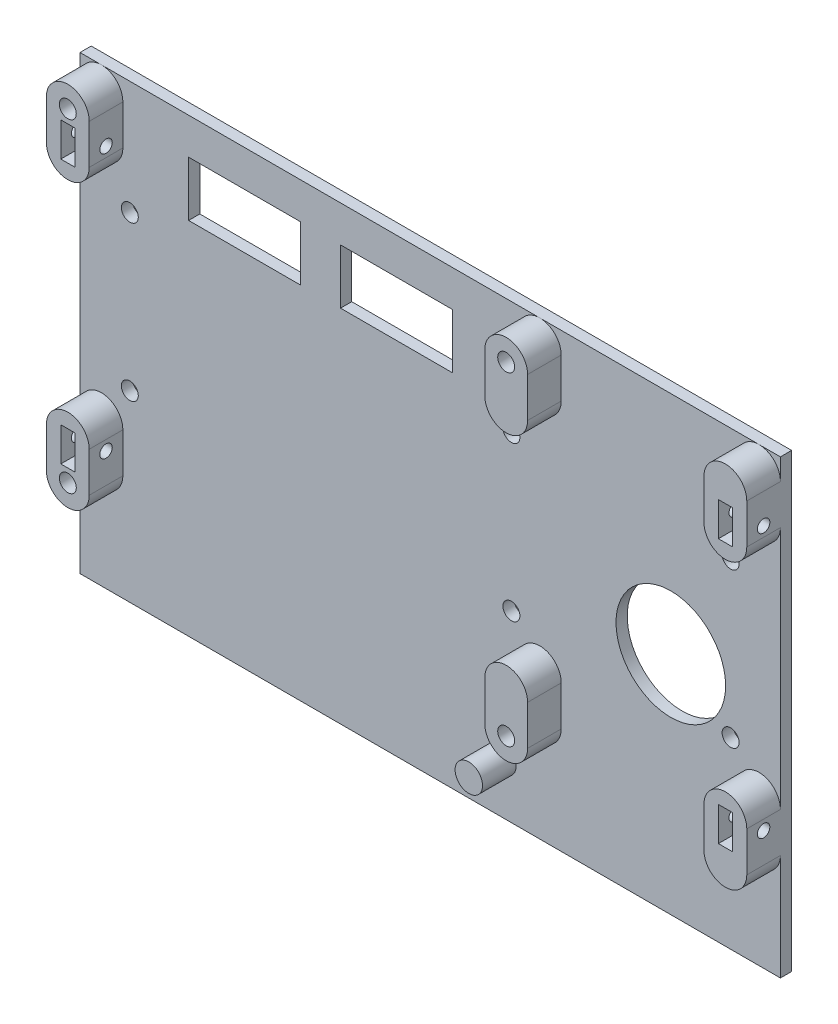
from build123d import *

# Parameters (mm, degrees)
BACK_START                               = -2.5
BACK_PLATE_BODY_OUTLINE_W                = 140.7
BACK_PLATE_BODY_OUTLINE_H                = 90.7
BACK_PLATE_BODY_OUTLINE_R                = 3.175426481
BACK_PLATE_BODY_OUTLINE_R_2              = 1.7
BACK_PLATE_BODY_OUTLINE_W_2              = 22.5
BACK_PLATE_BODY_OUTLINE_H_2              = 11
BACK_PLATE_BODY_DEPTH                    = 2.5
BACK_START_2                             = 1.4999999
BACK_PLATE_BODY_2_OUTLINE_R              = 3.175426481
BACK_PLATE_BODY_2_OUTLINE_R_2            = 1.7
BACK_PLATE_BODY_2_OUTLINE_R_3            = 2.75
BACK_PLATE_BODY_2_DEPTH                  = 5.0000001
BACK_PLATE_BODY_3_OUTLINE_R              = 2.75
BACK_PLATE_BODY_3_DEPTH                  = 1.9999999
BACK_START_3                             = 6.425426481
BACK_PLATE_BODY_4_OUTLINE_R              = 3.175426481
BACK_PLATE_BODY_4_DEPTH                  = 0.074573519
BACK_PLATE_BODY_5_OUTLINE_R              = 3.175426481
BACK_PLATE_BODY_5_DEPTH                  = 0.074573419
BACK_START_4                             = 0.074573419
BACK_PLATE_BODY_6_OUTLINE_R              = 3.175426481
BACK_PLATE_BODY_6_DEPTH                  = 6.350853062
BACK_PLATE_BODY_7_OUTLINE_R              = 3.175426481
BACK_PLATE_BODY_7_DEPTH                  = 1.425426481
BACK_START_5                             = -42.05
BACK_PLATE_BODY_12_OUTLINE_R             = 3.175426481
BACK_PLATE_BODY_12_DEPTH                 = 84.1
BACK_START_6                             = -48.35
BACK_PLATE_BODY_13_OUTLINE_R             = 1.25
BACK_PLATE_BODY_13_DEPTH                 = 96.7
BACK_PLATE_OUTLINE_W                     = 140.7
BACK_PLATE_OUTLINE_H                     = 90.7
BACK_PLATE_OUTLINE_W_2                   = 96.6
BACK_PLATE_OUTLINE_H_2                   = 90.6
BACK_PLATE_OUTLINE_R                     = 1.7
BACK_PLATE_OUTLINE_R_2                   = 3.175426481
BACK_PLATE_DEPTH                         = 9
BACK_PLATE_2_OUTLINE_R                   = 3.175426481
BACK_PLATE_2_OUTLINE_R_2                 = 2.75
BACK_PLATE_2_DEPTH                       = 6.5
BACK_PLATE_3_OUTLINE_W                   = 96.6
BACK_PLATE_3_OUTLINE_H                   = 90.6
BACK_PLATE_3_OUTLINE_R                   = 3.175426481
BACK_PLATE_3_DEPTH                       = 0.25
BACK_START_7                             = -2.25
BACK_PLATE_4_DEPTH                       = 2.25
STOP_BUTTON_EXTENSION_SKETCH_W           = 44
STOP_BUTTON_EXTENSION_SKETCH_H           = 90.6
STOP_BUTTON_EXTENSION_SKETCH_R           = 1.7
STOP_BUTTON_EXTENSION_SKETCH_R_2         = 11
STOP_BUTTON_EXTENSION_DEPTH              = 2.25
STAND_OFFS_SKETCH_R                      = 2.75
STAND_OFFS_SKETCH_R_2                    = 1.7
STAND_OFFS_DEPTH                         = 6.75
STOP_BUTTON_STAND_OFFS_EXTRUDE_DEPTH     = 6.75
PCB_NUT_NO_SUPPORT_CHAMFER_SIZE          = 1.5
TOP_CONNECTORS_SKETCH_R                  = 1.25
TOP_CONNECTORS_LEFT_CUT_DEPTH            = 104.038548612
TOP_START                                = 83.7
TOP_CONNECTORS_SKETCH_3_R                = 1.25
TOP_CONNECTORS_STOP_BUTTON_CUT_DEPTH     = 8.6
TOP_START_2                              = -44
TOP_CONNECTORS_LEFT_NUT_CUT_DEPTH        = 1.4
TOP_START_3                              = 88
TOP_CONNECTORS_STOP_BUTTON_NUT_CUT_DEPTH = 1.4


with BuildPart() as part:
    # Back Plate Body: read off the stored shape, not the designer's step
    # Back Plate Body outline → Back Plate Body (new body)
    with BuildSketch(Plane.XY.offset(BACK_START)):
        with Locations((22, 0)):
            Rectangle(BACK_PLATE_BODY_OUTLINE_W, BACK_PLATE_BODY_OUTLINE_H)
        with Locations((44, -24)):
            Circle(BACK_PLATE_BODY_OUTLINE_R, mode=Mode.SUBTRACT)
        with Locations((-38.35, -7.5)):
            Circle(BACK_PLATE_BODY_OUTLINE_R_2, mode=Mode.SUBTRACT)
        with Locations((38.35, -7.5)):
            Circle(BACK_PLATE_BODY_OUTLINE_R_2, mode=Mode.SUBTRACT)
        with Locations((82.35, -7.5)):
            Circle(BACK_PLATE_BODY_OUTLINE_R_2, mode=Mode.SUBTRACT)
        with Locations((-38.35, 22.5)):
            Circle(BACK_PLATE_BODY_OUTLINE_R_2, mode=Mode.SUBTRACT)
        with Locations((-15.25, 32.5)):
            Rectangle(BACK_PLATE_BODY_OUTLINE_W_2, BACK_PLATE_BODY_OUTLINE_H_2, mode=Mode.SUBTRACT)
        with Locations((15.25, 32.5)):
            Rectangle(BACK_PLATE_BODY_OUTLINE_W_2, BACK_PLATE_BODY_OUTLINE_H_2, mode=Mode.SUBTRACT)
        with Locations((38.35, 22.5)):
            Circle(BACK_PLATE_BODY_OUTLINE_R_2, mode=Mode.SUBTRACT)
        with Locations((82.35, 22.5)):
            Circle(BACK_PLATE_BODY_OUTLINE_R_2, mode=Mode.SUBTRACT)
        with Locations((-44, -24)):
            Circle(BACK_PLATE_BODY_OUTLINE_R, mode=Mode.SUBTRACT)
        with Locations((-44, 41)):
            Circle(BACK_PLATE_BODY_OUTLINE_R, mode=Mode.SUBTRACT)
        with Locations((44, 41)):
            Circle(BACK_PLATE_BODY_OUTLINE_R, mode=Mode.SUBTRACT)
    extrude(amount=BACK_PLATE_BODY_DEPTH)



with BuildPart() as body_2:
    # Back Plate Body 2 outline → Back Plate Body 2 (new body)
    # profile 1 of 5: a face of its own
    with BuildSketch(Plane.XY.offset(BACK_START_2)):
        with Locations((-44, 41)):
            Circle(BACK_PLATE_BODY_2_OUTLINE_R)
        with Locations((-44, 41)):
            Circle(BACK_PLATE_BODY_2_OUTLINE_R_2, mode=Mode.SUBTRACT)
    # profile 2 of 5: a face of its own
    with BuildSketch(Plane.XY.offset(BACK_START_2)):
        with Locations((44, 41)):
            Circle(BACK_PLATE_BODY_2_OUTLINE_R)
        with Locations((44, 41)):
            Circle(BACK_PLATE_BODY_2_OUTLINE_R_2, mode=Mode.SUBTRACT)
    # profile 3 of 5: a face of its own
    with BuildSketch(Plane.XY.offset(BACK_START_2)):
        with Locations((-44, -24)):
            Circle(BACK_PLATE_BODY_2_OUTLINE_R)
        with Locations((-44, -24)):
            Circle(BACK_PLATE_BODY_2_OUTLINE_R_2, mode=Mode.SUBTRACT)
    # profile 4 of 5: a face of its own
    with BuildSketch(Plane.XY.offset(BACK_START_2)):
        with Locations((44, -24)):
            Circle(BACK_PLATE_BODY_2_OUTLINE_R)
        with Locations((44, -24)):
            Circle(BACK_PLATE_BODY_2_OUTLINE_R_2, mode=Mode.SUBTRACT)
    # profile 5 of 5: a face of its own
    with BuildSketch(Plane.XY.offset(BACK_START_2)):
        with Locations((36.5, -35)):
            Circle(BACK_PLATE_BODY_2_OUTLINE_R_3)
    extrude(amount=BACK_PLATE_BODY_2_DEPTH)


with BuildPart() as part_1:
    add(part.part)

    add(body_2.part)  # Back Plate Body 3 merges body 2
    # Back Plate Body 3 outline → Back Plate Body 3 (add)
    with BuildSketch(Plane.XY):
        with Locations((36.5, -35)):
            Circle(BACK_PLATE_BODY_3_OUTLINE_R)
    extrude(amount=BACK_PLATE_BODY_3_DEPTH)

    # Back Plate Body 4 outline → Back Plate Body 4 (add)
    # profile 1 of 4: a face of its own
    with BuildSketch(Plane.XY.offset(BACK_START_3)):
        with BuildLine():
            ThreePointArc((48.35, -16), (44, -11.65), (39.65, -16))
            Line((39.65, -16), (39.65, -24))
            ThreePointArc((39.65, -24), (44, -28.35), (48.35, -24))
            Line((48.35, -24), (48.35, -16))
        make_face()
        with Locations((44, -24)):
            Circle(BACK_PLATE_BODY_4_OUTLINE_R, mode=Mode.SUBTRACT)
    # profile 2 of 4: a face of its own
    with BuildSketch(Plane.XY.offset(BACK_START_3)):
        with BuildLine():
            ThreePointArc((39.65, 33), (44, 28.65), (48.35, 33))
            Line((48.35, 33), (48.35, 41))
            ThreePointArc((48.35, 41), (44, 45.35), (39.65, 41))
            Line((39.65, 41), (39.65, 33))
        make_face()
        with Locations((44, 41)):
            Circle(BACK_PLATE_BODY_4_OUTLINE_R, mode=Mode.SUBTRACT)
    # profile 3 of 4: a face of its own
    with BuildSketch(Plane.XY.offset(BACK_START_3)):
        with BuildLine():
            ThreePointArc((-39.65, 41), (-44, 45.35), (-48.35, 41))
            Line((-48.35, 41), (-48.35, 33))
            ThreePointArc((-48.35, 33), (-44, 28.65), (-39.65, 33))
            Line((-39.65, 33), (-39.65, 41))
        make_face()
        with Locations((-44, 41)):
            Circle(BACK_PLATE_BODY_4_OUTLINE_R, mode=Mode.SUBTRACT)
    # profile 4 of 4: a face of its own
    with BuildSketch(Plane.XY.offset(BACK_START_3)):
        with BuildLine():
            Line((-48.35, -16), (-48.35, -24))
            ThreePointArc((-48.35, -24), (-44, -28.35), (-39.65, -24))
            Line((-39.65, -24), (-39.65, -16))
            ThreePointArc((-39.65, -16), (-44, -11.65), (-48.35, -16))
        make_face()
        with Locations((-44, -24)):
            Circle(BACK_PLATE_BODY_4_OUTLINE_R, mode=Mode.SUBTRACT)
    extrude(amount=BACK_PLATE_BODY_4_DEPTH)

    # Back Plate Body 5 outline → Back Plate Body 5 (add)
    # profile 1 of 4: a face of its own
    with BuildSketch(Plane.XY):
        with BuildLine():
            ThreePointArc((48.35, -16), (44, -11.65), (39.65, -16))
            Line((39.65, -16), (39.65, -24))
            ThreePointArc((39.65, -24), (44, -28.35), (48.35, -24))
            Line((48.35, -24), (48.35, -16))
        make_face()
        with Locations((44, -24)):
            Circle(BACK_PLATE_BODY_5_OUTLINE_R, mode=Mode.SUBTRACT)
    # profile 2 of 4: a face of its own
    with BuildSketch(Plane.XY):
        with BuildLine():
            ThreePointArc((39.65, 33), (44, 28.65), (48.35, 33))
            Line((48.35, 33), (48.35, 41))
            ThreePointArc((48.35, 41), (44, 45.35), (39.65, 41))
            Line((39.65, 41), (39.65, 33))
        make_face()
        with Locations((44, 41)):
            Circle(BACK_PLATE_BODY_5_OUTLINE_R, mode=Mode.SUBTRACT)
    # profile 3 of 4: a face of its own
    with BuildSketch(Plane.XY):
        with BuildLine():
            ThreePointArc((-39.65, 41), (-44, 45.35), (-48.35, 41))
            Line((-48.35, 41), (-48.35, 33))
            ThreePointArc((-48.35, 33), (-44, 28.65), (-39.65, 33))
            Line((-39.65, 33), (-39.65, 41))
        make_face()
        with Locations((-44, 41)):
            Circle(BACK_PLATE_BODY_5_OUTLINE_R, mode=Mode.SUBTRACT)
    # profile 4 of 4: a face of its own
    with BuildSketch(Plane.XY):
        with BuildLine():
            Line((-48.35, -16), (-48.35, -24))
            ThreePointArc((-48.35, -24), (-44, -28.35), (-39.65, -24))
            Line((-39.65, -24), (-39.65, -16))
            ThreePointArc((-39.65, -16), (-44, -11.65), (-48.35, -16))
        make_face()
        with Locations((-44, -24)):
            Circle(BACK_PLATE_BODY_5_OUTLINE_R, mode=Mode.SUBTRACT)
    extrude(amount=BACK_PLATE_BODY_5_DEPTH)

    # Back Plate Body 6 outline → Back Plate Body 6 (add)
    # profile 1 of 4: a face of its own
    with BuildSketch(Plane.XY.offset(BACK_START_4)):
        with BuildLine():
            ThreePointArc((48.35, -16), (44, -11.65), (39.65, -16))
            Line((39.65, -16), (39.65, -24))
            ThreePointArc((39.65, -24), (44, -28.35), (48.35, -24))
            Line((48.35, -24), (48.35, -16))
        make_face()
        with Locations((44, -24)):
            Circle(BACK_PLATE_BODY_6_OUTLINE_R, mode=Mode.SUBTRACT)
    # profile 2 of 4: a face of its own
    with BuildSketch(Plane.XY.offset(BACK_START_4)):
        with BuildLine():
            ThreePointArc((39.65, 33), (44, 28.65), (48.35, 33))
            Line((48.35, 33), (48.35, 41))
            ThreePointArc((48.35, 41), (44, 45.35), (39.65, 41))
            Line((39.65, 41), (39.65, 33))
        make_face()
        with Locations((44, 41)):
            Circle(BACK_PLATE_BODY_6_OUTLINE_R, mode=Mode.SUBTRACT)
    # profile 3 of 4: a face of its own
    with BuildSketch(Plane.XY.offset(BACK_START_4)):
        with BuildLine():
            ThreePointArc((-39.65, -16), (-44, -11.65), (-48.35, -16))
            Line((-48.35, -16), (-48.35, -24))
            ThreePointArc((-48.35, -24), (-44, -28.35), (-39.65, -24))
            Line((-39.65, -24), (-39.65, -16))
        make_face()
        with Locations((-44, -24)):
            Circle(BACK_PLATE_BODY_6_OUTLINE_R, mode=Mode.SUBTRACT)
    # profile 4 of 4: a face of its own
    with BuildSketch(Plane.XY.offset(BACK_START_4)):
        with BuildLine():
            ThreePointArc((-48.35, 33), (-44, 28.65), (-39.65, 33))
            Line((-39.65, 33), (-39.65, 41))
            ThreePointArc((-39.65, 41), (-44, 45.35), (-48.35, 41))
            Line((-48.35, 41), (-48.35, 33))
        make_face()
        with Locations((-44, 41)):
            Circle(BACK_PLATE_BODY_6_OUTLINE_R, mode=Mode.SUBTRACT)
    extrude(amount=BACK_PLATE_BODY_6_DEPTH)

    # Back Plate Body 7 outline → Back Plate Body 7 (add)
    with BuildSketch(Plane.XY.offset(BACK_START_4)):
        with Locations((-44, 41)):
            Circle(BACK_PLATE_BODY_7_OUTLINE_R)
        with Locations((44, 41)):
            Circle(BACK_PLATE_BODY_7_OUTLINE_R)
        with Locations((-44, -24)):
            Circle(BACK_PLATE_BODY_7_OUTLINE_R)
        with Locations((44, -24)):
            Circle(BACK_PLATE_BODY_7_OUTLINE_R)
    extrude(amount=BACK_PLATE_BODY_7_DEPTH)

    # Back Plate Body 8 outline → Back Plate Body 8 (revolve)
    with BuildSketch(Plane(origin=(-44, 41, 0), x_dir=(1, 0, 0), z_dir=(0, -1, 0))):
        Polygon((3.175426481, 0.074573419), (3.125426581, 0.074573419), (3.175426481, 0.024573519), align=None)
    revolve(axis=Axis((-44, 41, 0), (0, 0, 1)))

    # Back Plate Body 9 outline → Back Plate Body 9 (revolve)
    with BuildSketch(Plane(origin=(-44, -24, 0), x_dir=(1, 0, 0), z_dir=(0, -1, 0))):
        Polygon((3.175426481, 0.074573419), (3.125426581, 0.074573419), (3.175426481, 0.024573519), align=None)
    revolve(axis=Axis((-44, -24, 0), (0, 0, 1)))

    # Back Plate Body 10 outline → Back Plate Body 10 (revolve)
    with BuildSketch(Plane(origin=(44, -24, 0), x_dir=(1, 0, 0), z_dir=(0, -1, 0))):
        Polygon((3.175426481, 0.074573419), (3.125426581, 0.074573419), (3.175426481, 0.024573519), align=None)
    revolve(axis=Axis((44, -24, 0), (0, 0, 1)))

    # Back Plate Body 11 outline → Back Plate Body 11 (revolve)
    with BuildSketch(Plane(origin=(44, 41, 0), x_dir=(1, 0, 0), z_dir=(0, -1, 0))):
        Polygon((3.175426481, 0.074573419), (3.125426581, 0.074573419), (3.175426481, 0.024573519), align=None)
    revolve(axis=Axis((44, 41, 0), (0, 0, 1)))

    # Back Plate Body 12 outline → Back Plate Body 12 (cut)
    with BuildSketch(Plane.YZ.offset(BACK_START_5)):
        with Locations((35, 3.25)):
            Circle(BACK_PLATE_BODY_12_OUTLINE_R)
        with Locations((-18, 3.25)):
            Circle(BACK_PLATE_BODY_12_OUTLINE_R)
    extrude(amount=BACK_PLATE_BODY_12_DEPTH, mode=Mode.SUBTRACT)

    # Back Plate Body 13 outline → Back Plate Body 13 (cut)
    with BuildSketch(Plane.YZ.offset(BACK_START_6)):
        with Locations((35, 3.25)):
            Circle(BACK_PLATE_BODY_13_OUTLINE_R)
        with Locations((-18, 3.25)):
            Circle(BACK_PLATE_BODY_13_OUTLINE_R)
    extrude(amount=BACK_PLATE_BODY_13_DEPTH, mode=Mode.SUBTRACT)

    # Back Plate Body 14 outline → Back Plate Body 14 (revolve, cut)
    with BuildSketch(Plane(origin=(-44, 41, 0), x_dir=(1, 0, 0), z_dir=(0, -1, 0))):
        Polygon((3.125426581, 0.074573419), (1.7, 1.5), (0, 1.4999999), (0, 0.074573419), align=None)
    revolve(axis=Axis((-44, 41, 0), (0, 0, 1)), mode=Mode.SUBTRACT)

    # Back Plate Body 15 outline → Back Plate Body 15 (revolve, cut)
    with BuildSketch(Plane(origin=(-44, -24, 0), x_dir=(1, 0, 0), z_dir=(0, -1, 0))):
        Polygon((3.125426581, 0.074573419), (1.7, 1.5), (0, 1.4999999), (0, 0.074573419), align=None)
    revolve(axis=Axis((-44, -24, 0), (0, 0, 1)), mode=Mode.SUBTRACT)

    # Back Plate Body 16 outline → Back Plate Body 16 (revolve, cut)
    with BuildSketch(Plane(origin=(44, -24, 0), x_dir=(1, 0, 0), z_dir=(0, -1, 0))):
        Polygon((3.125426581, 0.074573419), (1.7, 1.5), (0, 1.4999999), (0, 0.074573419), align=None)
    revolve(axis=Axis((44, -24, 0), (0, 0, 1)), mode=Mode.SUBTRACT)

    # Back Plate Body 17 outline → Back Plate Body 17 (revolve, cut)
    with BuildSketch(Plane(origin=(44, 41, 0), x_dir=(1, 0, 0), z_dir=(0, -1, 0))):
        Polygon((3.125426581, 0.074573419), (1.7, 1.5), (0, 1.4999999), (0, 0.074573419), align=None)
    revolve(axis=Axis((44, 41, 0), (0, 0, 1)), mode=Mode.SUBTRACT)

    # Back Plate: read off the stored shape, not the designer's step
    # Back Plate outline → Back Plate (cut)
    # profile 1 of 9: a face of its own
    with BuildSketch(Plane.XY.offset(BACK_START)):
        with Locations((22, 0)):
            Rectangle(BACK_PLATE_OUTLINE_W, BACK_PLATE_OUTLINE_H)
        Rectangle(BACK_PLATE_OUTLINE_W_2, BACK_PLATE_OUTLINE_H_2, mode=Mode.SUBTRACT)
        with Locations((82.35, -7.5)):
            Circle(BACK_PLATE_OUTLINE_R, mode=Mode.SUBTRACT)
        with Locations((82.35, 22.5)):
            Circle(BACK_PLATE_OUTLINE_R, mode=Mode.SUBTRACT)
    # profile 2 of 9: a face of its own
    with BuildSketch(Plane.XY.offset(BACK_START)):
        with BuildLine():
            ThreePointArc((-39.94758837, -8.081129418), (-38.215106051, -10.197878976), (-36.70241163, -7.918870582))
            ThreePointArc((-36.70241163, -7.918870582), (-38.265106051, -9.197878976), (-39.94758837, -8.081129418))
        make_face()
    # profile 3 of 9: a face of its own
    with BuildSketch(Plane.XY.offset(BACK_START)):
        with BuildLine():
            ThreePointArc((-38.325, 20.800183833), (-36.6, 22.5), (-38.325, 24.199816167))
            ThreePointArc((-38.325, 24.199816167), (-36.65, 22.5), (-38.325, 20.800183833))
        make_face()
    # profile 4 of 9: a face of its own
    with BuildSketch(Plane.XY.offset(BACK_START)):
        with BuildLine():
            ThreePointArc((36.70241163, -7.918870582), (38.215106051, -10.197878976), (39.94758837, -8.081129418))
            ThreePointArc((39.94758837, -8.081129418), (38.265106051, -9.197878976), (36.70241163, -7.918870582))
        make_face()
    # profile 5 of 9: a face of its own
    with BuildSketch(Plane.XY.offset(BACK_START)):
        with BuildLine():
            ThreePointArc((38.325, 20.800183833), (36.65, 22.5), (38.325, 24.199816167))
            ThreePointArc((38.325, 24.199816167), (36.6, 22.5), (38.325, 20.800183833))
        make_face()
    # profile 6 of 9: a face of its own
    with BuildSketch(Plane.XY.offset(BACK_START)):
        with Locations((-44, 41)):
            Circle(BACK_PLATE_OUTLINE_R_2)
        with Locations((-44, 41)):
            Circle(BACK_PLATE_OUTLINE_R, mode=Mode.SUBTRACT)
    # profile 7 of 9: a face of its own
    with BuildSketch(Plane.XY.offset(BACK_START)):
        with Locations((44, 41)):
            Circle(BACK_PLATE_OUTLINE_R_2)
        with Locations((44, 41)):
            Circle(BACK_PLATE_OUTLINE_R, mode=Mode.SUBTRACT)
    # profile 8 of 9: a face of its own
    with BuildSketch(Plane.XY.offset(BACK_START)):
        with Locations((-44, -24)):
            Circle(BACK_PLATE_OUTLINE_R_2)
        with Locations((-44, -24)):
            Circle(BACK_PLATE_OUTLINE_R, mode=Mode.SUBTRACT)
    # profile 9 of 9: a face of its own
    with BuildSketch(Plane.XY.offset(BACK_START)):
        with Locations((44, -24)):
            Circle(BACK_PLATE_OUTLINE_R_2)
        with Locations((44, -24)):
            Circle(BACK_PLATE_OUTLINE_R, mode=Mode.SUBTRACT)
    extrude(amount=BACK_PLATE_DEPTH, mode=Mode.SUBTRACT)

    # Back Plate 2 outline → Back Plate 2 (cut)
    # profile 1 of 5: a face of its own
    with BuildSketch(Plane.XY):
        with BuildLine():
            ThreePointArc((39.65, -24), (43.670227351, -28.337481988), (48.3, -24.657647322))
            Line((48.3, -24.657647322), (48.3, -15.342352678))
            ThreePointArc((48.3, -15.342352678), (43.670227351, -11.662518012), (39.65, -16))
            Line((39.65, -16), (39.65, -24))
        make_face()
        with Locations((44, -24)):
            Circle(BACK_PLATE_2_OUTLINE_R, mode=Mode.SUBTRACT)
    # profile 2 of 5: a face of its own
    with BuildSketch(Plane.XY):
        with BuildLine():
            Line((-48.3, -15.342352678), (-48.3, -24.657647322))
            ThreePointArc((-48.3, -24.657647322), (-43.670227351, -28.337481988), (-39.65, -24))
            Line((-39.65, -24), (-39.65, -16))
            ThreePointArc((-39.65, -16), (-43.670227351, -11.662518012), (-48.3, -15.342352678))
        make_face()
        with Locations((-44, -24)):
            Circle(BACK_PLATE_2_OUTLINE_R, mode=Mode.SUBTRACT)
    # profile 3 of 5: a face of its own
    with BuildSketch(Plane.XY):
        with BuildLine():
            ThreePointArc((39.65, 33), (43.670227351, 28.662518012), (48.3, 32.342352678))
            Line((48.3, 32.342352678), (48.3, 41.657647322))
            ThreePointArc((48.3, 41.657647322), (47.075914498, 44.075914498), (44.657647322, 45.3))
            Line((44.657647322, 45.3), (43.342352678, 45.3))
            ThreePointArc((43.342352678, 45.3), (40.699752596, 43.833878451), (39.65, 41))
            Line((39.65, 41), (39.65, 33))
        make_face()
        with Locations((44, 41)):
            Circle(BACK_PLATE_2_OUTLINE_R, mode=Mode.SUBTRACT)
    # profile 4 of 5: a face of its own
    with BuildSketch(Plane.XY):
        with BuildLine():
            Line((-48.3, 41.657647322), (-48.3, 32.342352678))
            ThreePointArc((-48.3, 32.342352678), (-43.670227351, 28.662518012), (-39.65, 33))
            Line((-39.65, 33), (-39.65, 41))
            ThreePointArc((-39.65, 41), (-40.699752596, 43.833878451), (-43.342352678, 45.3))
            Line((-43.342352678, 45.3), (-44.657647322, 45.3))
            ThreePointArc((-44.657647322, 45.3), (-47.075914498, 44.075914498), (-48.3, 41.657647322))
        make_face()
        with Locations((-44, 41)):
            Circle(BACK_PLATE_2_OUTLINE_R, mode=Mode.SUBTRACT)
    # profile 5 of 5: a face of its own
    with BuildSketch(Plane.XY):
        with Locations((36.5, -35)):
            Circle(BACK_PLATE_2_OUTLINE_R_2)
    extrude(amount=BACK_PLATE_2_DEPTH, mode=Mode.SUBTRACT)

    # Back Plate 3 outline → Back Plate 3 (cut)
    with BuildSketch(Plane.XY.offset(BACK_START)):
        Rectangle(BACK_PLATE_3_OUTLINE_W, BACK_PLATE_3_OUTLINE_H)
        with BuildLine():
            ThreePointArc((-36.70241163, -7.918870582), (-38.215106051, -10.197878976), (-39.94758837, -8.081129418))
            ThreePointArc((-39.94758837, -8.081129418), (-38.434893949, -5.802121024), (-36.70241163, -7.918870582))
        make_face(mode=Mode.SUBTRACT)
        with BuildLine():
            ThreePointArc((39.94758837, -8.081129418), (38.215106051, -10.197878976), (36.70241163, -7.918870582))
            ThreePointArc((36.70241163, -7.918870582), (38.434893949, -5.802121024), (39.94758837, -8.081129418))
        make_face(mode=Mode.SUBTRACT)
        with BuildLine():
            ThreePointArc((-38.325, 24.199816167), (-36.6, 22.5), (-38.325, 20.800183833))
            ThreePointArc((-38.325, 20.800183833), (-40.05, 22.5), (-38.325, 24.199816167))
        make_face(mode=Mode.SUBTRACT)
        with BuildLine():
            ThreePointArc((38.325, 20.800183833), (36.6, 22.5), (38.325, 24.199816167))
            ThreePointArc((38.325, 24.199816167), (40.05, 22.5), (38.325, 20.800183833))
        make_face(mode=Mode.SUBTRACT)
        with Locations((-44, -24)):
            Circle(BACK_PLATE_3_OUTLINE_R, mode=Mode.SUBTRACT)
        with Locations((-44, 41)):
            Circle(BACK_PLATE_3_OUTLINE_R, mode=Mode.SUBTRACT)
        with Locations((44, 41)):
            Circle(BACK_PLATE_3_OUTLINE_R, mode=Mode.SUBTRACT)
        with Locations((44, -24)):
            Circle(BACK_PLATE_3_OUTLINE_R, mode=Mode.SUBTRACT)
    extrude(amount=BACK_PLATE_3_DEPTH, mode=Mode.SUBTRACT)

    # Back Plate 4 outline → Back Plate 4 (add)
    with BuildSketch(Plane.XY.offset(BACK_START_7)):
        with BuildLine():
            ThreePointArc((-39.94758837, -8.081129418), (-38.384893949, -6.802121024), (-36.70241163, -7.918870582))
            ThreePointArc((-36.70241163, -7.918870582), (-38.434893949, -5.802121024), (-39.94758837, -8.081129418))
        make_face()
        with BuildLine():
            ThreePointArc((-38.325, 20.800183833), (-40, 22.5), (-38.325, 24.199816167))
            ThreePointArc((-38.325, 24.199816167), (-40.05, 22.5), (-38.325, 20.800183833))
        make_face()
        with BuildLine():
            ThreePointArc((36.70241163, -7.918870582), (38.384893949, -6.802121024), (39.94758837, -8.081129418))
            ThreePointArc((39.94758837, -8.081129418), (38.434893949, -5.802121024), (36.70241163, -7.918870582))
        make_face()
        with BuildLine():
            ThreePointArc((38.325, 24.199816167), (40, 22.5), (38.325, 20.800183833))
            ThreePointArc((38.325, 20.800183833), (40.05, 22.5), (38.325, 24.199816167))
        make_face()
    extrude(amount=BACK_PLATE_4_DEPTH)

    # Stop Button Extension Sketch → Stop Button Extension (add)
    with BuildSketch(Plane.XY):
        with Locations((70.3, 0)):
            Rectangle(STOP_BUTTON_EXTENSION_SKETCH_W, STOP_BUTTON_EXTENSION_SKETCH_H)
        with Locations((82.3, 22.5)):
            Circle(STOP_BUTTON_EXTENSION_SKETCH_R, mode=Mode.SUBTRACT)
        with Locations((82.3, -8.5)):
            Circle(STOP_BUTTON_EXTENSION_SKETCH_R, mode=Mode.SUBTRACT)
        with Locations((70.3, 0)):
            Circle(STOP_BUTTON_EXTENSION_SKETCH_R_2, mode=Mode.SUBTRACT)
    extrude(amount=-STOP_BUTTON_EXTENSION_DEPTH)

    # Stand Offs Sketch → Stand Offs (add)
    # profile 1 of 5: a face of its own
    with BuildSketch(Plane.XY):
        with Locations(Location((36.5, -35, 0), (0, 0, 180))):
            Circle(STAND_OFFS_SKETCH_R)
    # profile 2 of 5: a face of its own
    with BuildSketch(Plane.XY):
        with BuildLine():
            Line((-39.7, 33), (-39.7, 41))
            ThreePointArc((-39.7, 41), (-44, 45.3), (-48.3, 41))
            Line((-48.3, 41), (-48.3, 33))
            ThreePointArc((-48.3, 33), (-44, 28.7), (-39.7, 33))
        make_face()
        with Locations((-44, 41)):
            Circle(STAND_OFFS_SKETCH_R_2, mode=Mode.SUBTRACT)
    # profile 3 of 5: a face of its own
    with BuildSketch(Plane.XY):
        with BuildLine():
            Line((48.3, 41), (48.3, 33))
            ThreePointArc((48.3, 33), (44, 28.7), (39.7, 33))
            Line((39.7, 33), (39.7, 41))
            ThreePointArc((39.7, 41), (44, 45.3), (48.3, 41))
        make_face()
        with Locations(Location((44, 41, 0), (0, 0, 180))):
            Circle(STAND_OFFS_SKETCH_R_2, mode=Mode.SUBTRACT)
    # profile 4 of 5: a face of its own
    with BuildSketch(Plane.XY):
        with BuildLine():
            Line((39.7, -16), (39.7, -24))
            ThreePointArc((39.7, -24), (44, -28.3), (48.3, -24))
            Line((48.3, -24), (48.3, -16))
            ThreePointArc((48.3, -16), (44, -11.7), (39.7, -16))
        make_face()
        with Locations((44, -24)):
            Circle(STAND_OFFS_SKETCH_R_2, mode=Mode.SUBTRACT)
    # profile 5 of 5: a face of its own
    with BuildSketch(Plane.XY):
        with BuildLine():
            Line((-48.3, -24), (-48.3, -16))
            ThreePointArc((-48.3, -16), (-44, -11.7), (-39.7, -16))
            Line((-39.7, -16), (-39.7, -24))
            ThreePointArc((-39.7, -24), (-44, -28.3), (-48.3, -24))
        make_face()
        with Locations(Location((-44, -24, 0), (0, 0, 180))):
            Circle(STAND_OFFS_SKETCH_R_2, mode=Mode.SUBTRACT)
    extrude(amount=STAND_OFFS_DEPTH)

    # Stop Button Stand Offs Sketch → Stop Button Stand Offs Extrude (add)
    with BuildSketch(Plane.XY):
        with BuildLine():
            Line((83.7, 41), (83.7, 33))
            ThreePointArc((83.7, 33), (88, 28.7), (92.3, 33))
            Line((92.3, 33), (92.3, 41))
            ThreePointArc((92.3, 41), (88, 45.3), (83.7, 41))
        make_face()
        with BuildLine():
            Line((83.7, -16), (83.7, -24))
            ThreePointArc((83.7, -24), (88, -28.3), (92.3, -24))
            Line((92.3, -24), (92.3, -16))
            ThreePointArc((92.3, -16), (88, -11.7), (83.7, -16))
        make_face()
    extrude(amount=STOP_BUTTON_STAND_OFFS_EXTRUDE_DEPTH)

    # PCB Nut No Support Chamfer
    # the kernel refuses this chamfer: 1.5 mm, written as the material it takes off along each edge
    with BuildSketch(Plane(origin=(-44, 41, 0), x_dir=(1, 0, 0), z_dir=(0, -1, 0))) as pcb_nut_no_support_chamfer_piece_1_section:
        Polygon((1.7 + PCB_NUT_NO_SUPPORT_CHAMFER_SIZE, 0), (1.7, PCB_NUT_NO_SUPPORT_CHAMFER_SIZE), (1.7, 0), align=None)
    pcb_nut_no_support_chamfer_piece_1 = revolve(axis=Axis((-44, 41, 0), (0, 0, 1)), mode=Mode.PRIVATE)
    pcb_nut_no_support_chamfer_piece_1 = pcb_nut_no_support_chamfer_piece_1 & Plane(origin=(-44, 41, 0), x_dir=(1, 0, 0), z_dir=(0, 0, -1)) * Cylinder(3.175426481, 13, mode=Mode.PRIVATE)
    add(pcb_nut_no_support_chamfer_piece_1, mode=Mode.SUBTRACT)
    with BuildSketch(Plane(origin=(-44, -24, 0), x_dir=(-1, 0, 0), z_dir=(0, 1, 0))) as pcb_nut_no_support_chamfer_piece_2_section:
        Polygon((1.7 + PCB_NUT_NO_SUPPORT_CHAMFER_SIZE, 0), (1.7, PCB_NUT_NO_SUPPORT_CHAMFER_SIZE), (1.7, 0), align=None)
    pcb_nut_no_support_chamfer_piece_2 = revolve(axis=Axis((-44, -24, 0), (0, 0, 1)), mode=Mode.PRIVATE)
    pcb_nut_no_support_chamfer_piece_2 = pcb_nut_no_support_chamfer_piece_2 & Plane(origin=(-44, -24, 0), x_dir=(1, 0, 0), z_dir=(0, 0, -1)) * Cylinder(3.175426481, 13, mode=Mode.PRIVATE)
    add(pcb_nut_no_support_chamfer_piece_2, mode=Mode.SUBTRACT)
    with BuildSketch(Plane(origin=(44, -24, 0), x_dir=(1, 0, 0), z_dir=(0, -1, 0))) as pcb_nut_no_support_chamfer_piece_3_section:
        Polygon((1.7 + PCB_NUT_NO_SUPPORT_CHAMFER_SIZE, 0), (1.7, PCB_NUT_NO_SUPPORT_CHAMFER_SIZE), (1.7, 0), align=None)
    pcb_nut_no_support_chamfer_piece_3 = revolve(axis=Axis((44, -24, 0), (0, 0, 1)), mode=Mode.PRIVATE)
    pcb_nut_no_support_chamfer_piece_3 = pcb_nut_no_support_chamfer_piece_3 & Plane(origin=(44, -24, 0), x_dir=(1, 0, 0), z_dir=(0, 0, -1)) * Cylinder(3.175426481, 13, mode=Mode.PRIVATE)
    add(pcb_nut_no_support_chamfer_piece_3, mode=Mode.SUBTRACT)
    with BuildSketch(Plane(origin=(44, 41, 0), x_dir=(-1, 0, 0), z_dir=(0, 1, 0))) as pcb_nut_no_support_chamfer_piece_4_section:
        Polygon((1.7 + PCB_NUT_NO_SUPPORT_CHAMFER_SIZE, 0), (1.7, PCB_NUT_NO_SUPPORT_CHAMFER_SIZE), (1.7, 0), align=None)
    pcb_nut_no_support_chamfer_piece_4 = revolve(axis=Axis((44, 41, 0), (0, 0, 1)), mode=Mode.PRIVATE)
    pcb_nut_no_support_chamfer_piece_4 = pcb_nut_no_support_chamfer_piece_4 & Plane(origin=(44, 41, 0), x_dir=(1, 0, 0), z_dir=(0, 0, -1)) * Cylinder(3.175426481, 13, mode=Mode.PRIVATE)
    add(pcb_nut_no_support_chamfer_piece_4, mode=Mode.SUBTRACT)

    # Top Connectors Sketch → Top Connectors Left Cut (cut, through all)
    with BuildSketch(Plane(origin=(0, 0, 0), x_dir=(0, 0, -1), z_dir=(1, 0, 0))):
        with Locations((-3.375, 35)):
            Circle(TOP_CONNECTORS_SKETCH_R)
        with Locations((-3.375, -18)):
            Circle(TOP_CONNECTORS_SKETCH_R)
    extrude(amount=-TOP_CONNECTORS_LEFT_CUT_DEPTH, mode=Mode.SUBTRACT)

    # Top Connectors Sketch<3> → Top Connectors Stop Button Cut (cut)
    with BuildSketch(Plane(origin=(0, 0, 0), x_dir=(0, 0, -1), z_dir=(1, 0, 0)).offset(TOP_START)):
        with Locations((-3.375, 35)):
            Circle(TOP_CONNECTORS_SKETCH_3_R)
        with Locations((-3.375, -18)):
            Circle(TOP_CONNECTORS_SKETCH_3_R)
    extrude(amount=TOP_CONNECTORS_STOP_BUTTON_CUT_DEPTH, mode=Mode.SUBTRACT)

    # Top Connectors Nut Sketch → Top Connectors Left Nut Cut (cut, symmetric)
    with BuildSketch(Plane(origin=(0, 0, 0), x_dir=(0, 0, -1), z_dir=(1, 0, 0)).offset(TOP_START_2)):
        with BuildLine():
            Line((-3.375, 38.406366588), (-10.125, 38.406366588))
            Line((-10.125, 38.406366588), (-10.125, 31.593633412))
            Line((-10.125, 31.593633412), (-3.375, 31.593633412))
            ThreePointArc((-3.375, 31.593633412), (0.031366588, 35), (-3.375, 38.406366588))
        make_face()
        with BuildLine():
            Line((-3.375, -21.406366588), (-10.125, -21.406366588))
            Line((-10.125, -21.406366588), (-10.125, -14.593633412))
            Line((-10.125, -14.593633412), (-3.375, -14.593633412))
            ThreePointArc((-3.375, -14.593633412), (0.031366588, -18), (-3.375, -21.406366588))
        make_face()
    extrude(amount=TOP_CONNECTORS_LEFT_NUT_CUT_DEPTH, both=True, mode=Mode.SUBTRACT)

    # Top Connectors Nut Sketch<4> → Top Connectors Stop Button Nut Cut (cut, symmetric)
    with BuildSketch(Plane(origin=(0, 0, 0), x_dir=(0, 0, -1), z_dir=(1, 0, 0)).offset(TOP_START_3)):
        with BuildLine():
            Line((-3.375, 38.406366588), (-10.125, 38.406366588))
            Line((-10.125, 38.406366588), (-10.125, 31.593633412))
            Line((-10.125, 31.593633412), (-3.375, 31.593633412))
            ThreePointArc((-3.375, 31.593633412), (0.031366588, 35), (-3.375, 38.406366588))
        make_face()
        with BuildLine():
            Line((-3.375, -21.406366588), (-10.125, -21.406366588))
            Line((-10.125, -21.406366588), (-10.125, -14.593633412))
            Line((-10.125, -14.593633412), (-3.375, -14.593633412))
            ThreePointArc((-3.375, -14.593633412), (0.031366588, -18), (-3.375, -21.406366588))
        make_face()
    extrude(amount=TOP_CONNECTORS_STOP_BUTTON_NUT_CUT_DEPTH, both=True, mode=Mode.SUBTRACT)


solid = part_1.part
